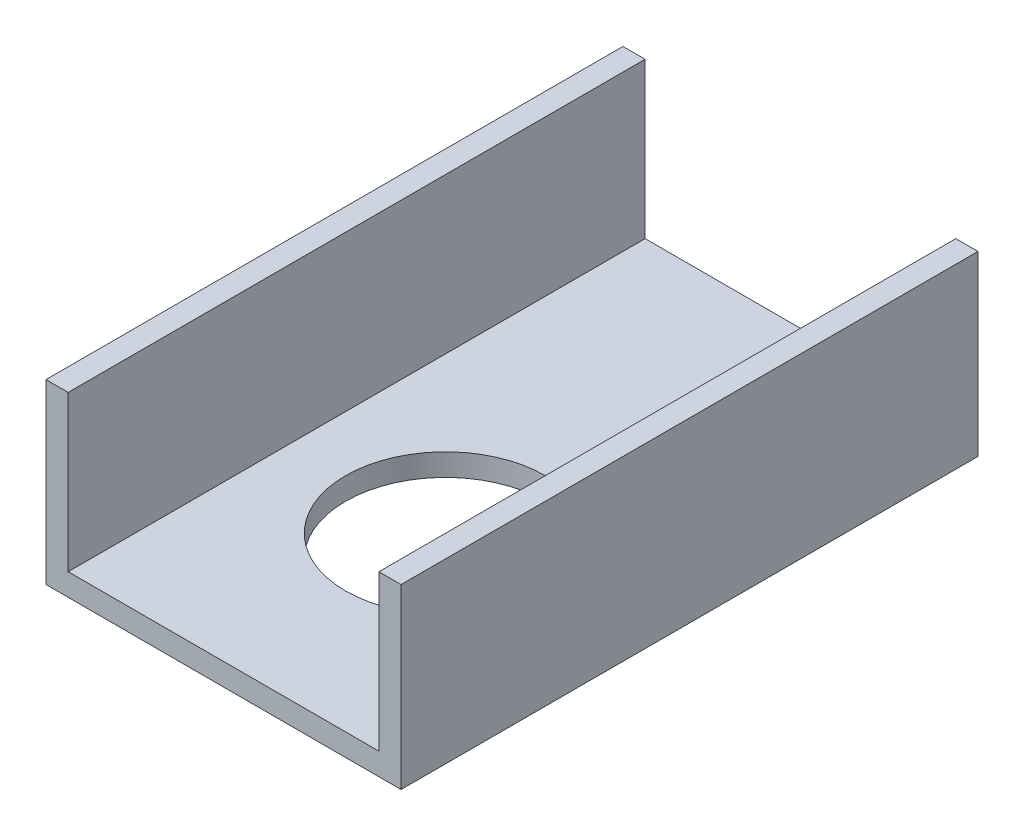
from build123d import *

# Parameters (mm, degrees)
BOSS_EXTRUDE1_DEPTH = 82.55
CUT_EXTRUDE1_REACH  = 102.201
SKETCH2_R           = 14.2875
CUT_EXTRUDE2_REACH  = 101.444
SKETCH3_W           = 3.175
SKETCH3_H           = 22.225


with BuildPart() as part:
    # Sketch1 → Boss-Extrude1 (new body)
    with BuildSketch(Plane.XY):
        Polygon((47.625, 3.175), (47.625, 25.4), (50.8, 25.4), (50.8, 0), (0, 0), (0, 25.4), (3.175, 25.4), (3.175, 3.175), align=None)
    extrude(amount=BOSS_EXTRUDE1_DEPTH)

    # Sketch2 → Cut-Extrude1 (cut, up to next)
    with BuildSketch(Plane.XZ, mode=Mode.PRIVATE) as cut_extrude1_sk1:
        with Locations((25.4, 50.8)):
            Circle(SKETCH2_R)
    cut_extrude1_tool1 = extrude(cut_extrude1_sk1.sketch, amount=-CUT_EXTRUDE1_REACH, mode=Mode.PRIVATE) & part.part
    add(cut_extrude1_tool1.solids().sort_by_distance((25.4, 0, 50.8))[0], mode=Mode.SUBTRACT)

    # Sketch3 → Cut-Extrude2 (cut, up to next)
    with BuildSketch(Plane(origin=(0, 3.175, 0), x_dir=(1, 0, 0), z_dir=(0, 1, 0)), mode=Mode.PRIVATE) as cut_extrude2_sk1:
        with Locations((46.0375, -11.1125)):
            Rectangle(SKETCH3_W, SKETCH3_H)
    cut_extrude2_tool1 = extrude(cut_extrude2_sk1.sketch, amount=-CUT_EXTRUDE2_REACH, mode=Mode.PRIVATE) & part.part
    add(cut_extrude2_tool1.solids().sort_by_distance((46.0375, 3.175, 11.1125))[0], mode=Mode.SUBTRACT)


solid = part.part
